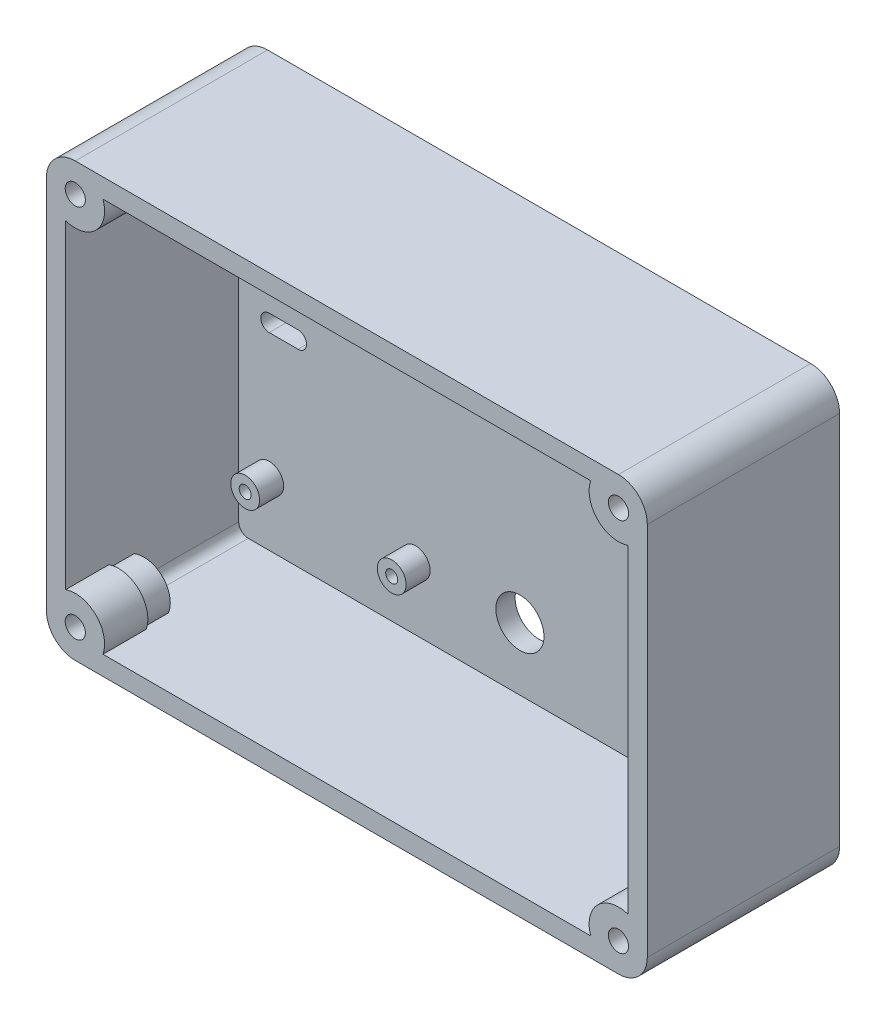
from build123d import *

# Parameters (mm, degrees)
SKETCH1_W                               = 125
SKETCH1_H                               = 90
BOSS_EXTRUDE1_DEPTH                     = 40
FILLET1_R                               = 6
CBORE_FOR_M5_HEX_HEAD_BOLT1_D           = 3
CBORE_FOR_M5_HEX_HEAD_BOLT1_DEPTH       = 12
CBORE_FOR_M5_HEX_HEAD_BOLT1_CBORE_D     = 4.2
CBORE_FOR_M5_HEX_HEAD_BOLT1_CBORE_DEPTH = 5
CBORE_FOR_M5_HEX_HEAD_BOLT1_TIP         = 0.901290929
SHELL2_START                            = 4
SHELL2_DEPTH                            = 36
SHELL2_2_DEPTH                          = 21.736908887
SHELL2_START_2                          = 23.633896721
SHELL2_3_DEPTH                          = 7.366103279
SKETCH7_R                               = 3
BOSS_EXTRUDE2_DEPTH                     = 5
M3X0_5_TAPPED_HOLE1_D                   = 2.5
M3X0_5_TAPPED_HOLE1_DEPTH               = 7.5
M3X0_5_TAPPED_HOLE1_TIP                 = 0.751075774
CUT_EXTRUDE1_DEPTH                      = 86.013234264
SKETCH7_5_R                             = 5
CUT_EXTRUDE2_DEPTH                      = 86.013234264
CUT_EXTRUDE3_DEPTH                      = 86.013234264


with BuildPart() as part:
    # Sketch1 → Boss-Extrude1 (new body)
    with BuildSketch(Plane.XY):
        Rectangle(SKETCH1_W, SKETCH1_H)
    extrude(amount=BOSS_EXTRUDE1_DEPTH)

    # Fillet1
    fillet1_edges = [part.edges().sort_by_distance(p)[0] for p in [
        (62.5, -45, 20),
        (-62.5, -45, 20),
        (-62.5, 45, 20),
        (62.5, 45, 20),
    ]]
    fillet(fillet1_edges, radius=FILLET1_R)

    # CBORE for M5 Hex Head Bolt1
    with Locations(Plane.XY.offset(40)):
        with Locations((-56.5, 39), (56.5, 39), (56.5, -39), (-56.5, -39)):
            CounterBoreHole(CBORE_FOR_M5_HEX_HEAD_BOLT1_D / 2, CBORE_FOR_M5_HEX_HEAD_BOLT1_CBORE_D / 2, CBORE_FOR_M5_HEX_HEAD_BOLT1_CBORE_DEPTH, depth=CBORE_FOR_M5_HEX_HEAD_BOLT1_DEPTH)
            with Locations((0, 0, -(CBORE_FOR_M5_HEX_HEAD_BOLT1_DEPTH + CBORE_FOR_M5_HEX_HEAD_BOLT1_TIP / 2))):  # 118° drill point
                Cone(0, CBORE_FOR_M5_HEX_HEAD_BOLT1_D / 2, CBORE_FOR_M5_HEX_HEAD_BOLT1_TIP, mode=Mode.SUBTRACT)

    # Shell2: read off the stored shape, not the designer's step
    # Shell2 outline → Shell2 (cut)
    with BuildSketch(Plane.XY.offset(SHELL2_START)):
        with BuildLine():
            ThreePointArc((58.5, 33.237188186), (52.186648635, 34.686648635), (50.737188186, 41))
            Line((50.737188186, 41), (-50.737188186, 41))
            ThreePointArc((-50.737188186, 41), (-52.186648635, 34.686648635), (-58.5, 33.237188186))
            Line((-58.5, 33.237188186), (-58.5, -33.237188186))
            ThreePointArc((-58.5, -33.237188186), (-52.186648635, -34.686648635), (-50.737188186, -41))
            Line((-50.737188186, -41), (50.737188186, -41))
            ThreePointArc((50.737188186, -41), (52.186648635, -34.686648635), (58.5, -33.237188186))
            Line((58.5, -33.237188186), (58.5, 33.237188186))
        make_face()
    extrude(amount=SHELL2_DEPTH, mode=Mode.SUBTRACT)

    # Shell2 2 outline → Shell2 2 (cut)
    with BuildSketch(Plane.XY.offset(SHELL2_START)):
        with BuildLine():
            Line((56.5, 41), (50.737188186, 41))
            ThreePointArc((50.737188186, 41), (52.186648635, 34.686648635), (58.5, 33.237188186))
            Line((58.5, 33.237188186), (58.5, 39))
            ThreePointArc((58.5, 39), (57.914213562, 40.414213562), (56.5, 41))
        make_face()
        with BuildLine():
            ThreePointArc((-58.5, 33.237188186), (-52.186648635, 34.686648635), (-50.737188186, 41))
            Line((-50.737188186, 41), (-56.5, 41))
            ThreePointArc((-56.5, 41), (-57.914213562, 40.414213562), (-58.5, 39))
            Line((-58.5, 39), (-58.5, 33.237188186))
        make_face()
        with BuildLine():
            ThreePointArc((58.5, -33.237188186), (52.186648635, -34.686648635), (50.737188186, -41))
            Line((50.737188186, -41), (56.5, -41))
            ThreePointArc((56.5, -41), (57.914213562, -40.414213562), (58.5, -39))
            Line((58.5, -39), (58.5, -33.237188186))
        make_face()
        with BuildLine():
            ThreePointArc((-50.737188186, -41), (-52.186648635, -34.686648635), (-58.5, -33.237188186))
            Line((-58.5, -33.237188186), (-58.5, -39))
            ThreePointArc((-58.5, -39), (-57.914213562, -40.414213562), (-56.5, -41))
            Line((-56.5, -41), (-50.737188186, -41))
        make_face()
    extrude(amount=SHELL2_2_DEPTH, mode=Mode.SUBTRACT)

    # Shell2 3 outline → Shell2 3 (cut)
    with BuildSketch(Plane.XY.offset(SHELL2_START_2)):
        with BuildLine():
            ThreePointArc((58.5, 33.876524617), (52.610912703, 35.110912703), (51.376524617, 41))
            Line((51.376524617, 41), (50.737188186, 41))
            ThreePointArc((50.737188186, 41), (52.186648635, 34.686648635), (58.5, 33.237188186))
            Line((58.5, 33.237188186), (58.5, 33.876524617))
        make_face()
        with BuildLine():
            ThreePointArc((-58.5, 33.237188186), (-52.186648635, 34.686648635), (-50.737188186, 41))
            Line((-50.737188186, 41), (-51.376524617, 41))
            ThreePointArc((-51.376524617, 41), (-52.610912703, 35.110912703), (-58.5, 33.876524617))
            Line((-58.5, 33.876524617), (-58.5, 33.237188186))
        make_face()
        with BuildLine():
            Line((58.5, -33.876524617), (58.5, -33.237188186))
            ThreePointArc((58.5, -33.237188186), (52.186648635, -34.686648635), (50.737188186, -41))
            Line((50.737188186, -41), (51.376524617, -41))
            ThreePointArc((51.376524617, -41), (52.610912703, -35.110912703), (58.5, -33.876524617))
        make_face()
        with BuildLine():
            ThreePointArc((-50.737188186, -41), (-52.186648635, -34.686648635), (-58.5, -33.237188186))
            Line((-58.5, -33.237188186), (-58.5, -33.876524617))
            ThreePointArc((-58.5, -33.876524617), (-52.610912703, -35.110912703), (-51.376524617, -41))
            Line((-51.376524617, -41), (-50.737188186, -41))
        make_face()
    extrude(amount=SHELL2_3_DEPTH, mode=Mode.SUBTRACT)

    # Shell2 4 outline → Shell2 4 (revolve)
    with BuildSketch(Plane(origin=(56.5, 39, 0), x_dir=(1, 0, 0), z_dir=(0, -1, 0))):
        Polygon((0, 25.736908889), (0, 22.432175483), (5.500000002, 25.736908889), align=None)
    revolve(axis=Axis((56.5, 39, 0), (0, 0, 1)))

    # Shell2 5 outline → Shell2 5 (revolve)
    with BuildSketch(Plane(origin=(56.5, -39, 0), x_dir=(1, 0, 0), z_dir=(0, -1, 0))):
        Polygon((0, 25.736908889), (0, 22.432175483), (5.500000002, 25.736908889), align=None)
    revolve(axis=Axis((56.5, -39, 0), (0, 0, 1)))

    # Shell2 6 outline → Shell2 6 (revolve)
    with BuildSketch(Plane(origin=(-56.5, 39, 0), x_dir=(1, 0, 0), z_dir=(0, -1, 0))):
        Polygon((0, 25.736908889), (0, 22.432175483), (5.500000002, 25.736908889), align=None)
    revolve(axis=Axis((-56.5, 39, 0), (0, 0, 1)))

    # Shell2 7 outline → Shell2 7 (revolve)
    with BuildSketch(Plane(origin=(-56.5, -39, 0), x_dir=(1, 0, 0), z_dir=(0, -1, 0))):
        Polygon((0, 25.736908887), (0, 22.432175483), (5.5, 25.736908887), align=None)
    revolve(axis=Axis((-56.5, -39, 0), (0, 0, 1)))

    # Sketch7 → Boss-Extrude2 (add)
    with BuildSketch(Plane.XY.offset(4)):
        with Locations((-52.15, 27.94)):
            Circle(SKETCH7_R)
        with Locations((-21.67, 27.94)):
            Circle(SKETCH7_R)
        with Locations((-52.15, -27.94)):
            Circle(SKETCH7_R)
        with Locations((-21.67, -27.94)):
            Circle(SKETCH7_R)
    extrude(amount=BOSS_EXTRUDE2_DEPTH)

    # M3x0.5 Tapped Hole1
    with Locations(Plane.XY.offset(9)):
        with Locations((-52.15, 27.94), (-21.67, 27.94), (-21.67, -27.94), (-52.15, -27.94)):
            Hole(M3X0_5_TAPPED_HOLE1_D / 2, depth=M3X0_5_TAPPED_HOLE1_DEPTH)
            with Locations((0, 0, -(M3X0_5_TAPPED_HOLE1_DEPTH + M3X0_5_TAPPED_HOLE1_TIP / 2))):  # 118° drill point
                Cone(0, M3X0_5_TAPPED_HOLE1_D / 2, M3X0_5_TAPPED_HOLE1_TIP, mode=Mode.SUBTRACT)

    # Sketch7<4> → Cut-Extrude1 (cut, through all)
    with BuildSketch(Plane.XY.offset(4)):
        with BuildLine():
            Line((-52.15, 1.75), (-46.15, 1.75))
            ThreePointArc((-46.15, 1.75), (-44.4, 0), (-46.15, -1.75))
            Line((-46.15, -1.75), (-52.15, -1.75))
            ThreePointArc((-52.15, -1.75), (-53.9, 0), (-52.15, 1.75))
        make_face()
    extrude(amount=-CUT_EXTRUDE1_DEPTH, mode=Mode.SUBTRACT)

    # Sketch7<5> → Cut-Extrude2 (cut, through all)
    with BuildSketch(Plane.XY.offset(4)):
        with Locations((0, -27.94)):
            Circle(SKETCH7_5_R)
    extrude(amount=-CUT_EXTRUDE2_DEPTH, mode=Mode.SUBTRACT)

    # Sketch7<6> → Cut-Extrude3 (cut, through all)
    with BuildSketch(Plane.XY.offset(4)):
        with BuildLine():
            Line((53.9, 3), (53.9, -3))
            ThreePointArc((53.9, -3), (52.15, -4.75), (50.4, -3))
            Line((50.4, -3), (50.4, 3))
            ThreePointArc((50.4, 3), (52.15, 4.75), (53.9, 3))
        make_face()
    extrude(amount=-CUT_EXTRUDE3_DEPTH, mode=Mode.SUBTRACT)


solid = part.part
